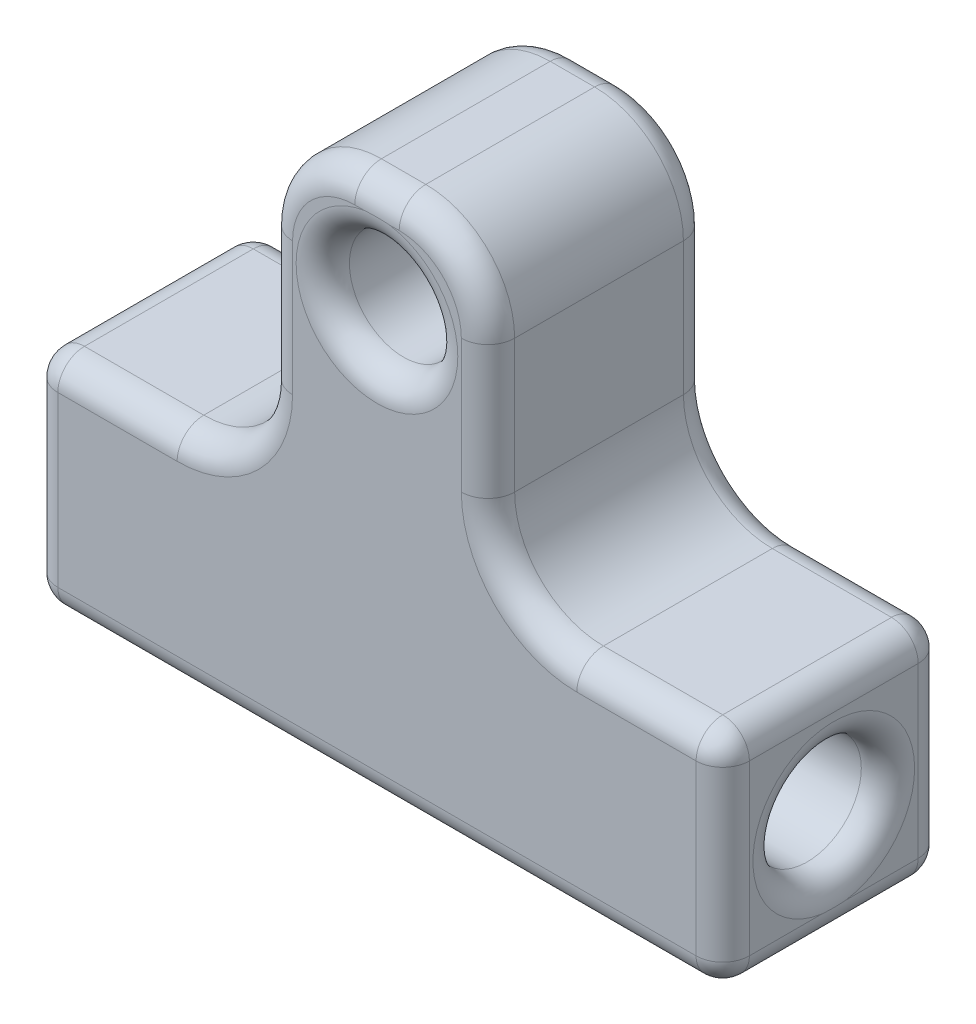
from build123d import *

# Parameters (mm, degrees)
SKETCH1_R           = 6.1
BOSS_EXTRUDE1_DEPTH = 25
SKETCH2_R           = 6.1
CUT_EXTRUDE1_DEPTH  = 88.09658729287669
FILLET1_R           = 3


with BuildPart() as part:
    # Sketch1 → Boss-Extrude1 (new body)
    with BuildSketch(Plane.XY):
        with BuildLine():
            Line((22.500000000000078, -5.000000000000004), (38.925619834710695, -5.000000000000004))
            Line((38.925619834710695, -5.000000000000004), (38.925619834710695, -30.000000000000007))
            Line((38.925619834710695, -30.000000000000007), (-38.92561983471068, -30.000000000000007))
            Line((-38.92561983471068, -30.000000000000007), (-38.92561983471068, -5.000000000000004))
            Line((-38.92561983471068, -5.000000000000004), (-22.500000000000068, -5.000000000000004))
            ThreePointArc((-22.500000000000068, -5.000000000000004), (-15.42893218813452, -2.0710678118654817), (-12.499999999999995, 5.000000000000067))
            Line((-12.499999999999995, 5.000000000000067), (-12.499999999999998, 19.99999999999993))
            ThreePointArc((-12.499999999999998, 19.99999999999993), (-9.571067811865476, 27.071067811865476), (-2.4999999999999294, 30))
            Line((-2.4999999999999294, 30), (2.499999999999931, 30))
            ThreePointArc((2.499999999999931, 30), (9.571067811865479, 27.071067811865476), (12.500000000000002, 19.99999999999993))
            Line((12.500000000000002, 19.99999999999993), (12.500000000000005, 5.000000000000065))
            ThreePointArc((12.500000000000005, 5.000000000000065), (15.428932188134532, -2.0710678118654826), (22.500000000000078, -5.000000000000004))
        make_face()
        with Locations((3.04e-15, 18)):
            Circle(SKETCH1_R, mode=Mode.SUBTRACT)
    extrude(amount=BOSS_EXTRUDE1_DEPTH)

    # Sketch2 → Cut-Extrude1 (cut, through all)
    with BuildSketch(Plane(origin=(38.925619834710695, 0, 0), x_dir=(0, 0, -1), z_dir=(1, 0, 0))):
        with Locations((-12.499999999999998, -18.000000000000007)):
            Circle(SKETCH2_R)
    extrude(amount=-CUT_EXTRUDE1_DEPTH, mode=Mode.SUBTRACT)

    # Fillet1
    # the kernel refuses this fillet: 3 mm, written as the material it takes off along each edge
    with BuildSketch(Plane(origin=(-35.92561983471068, -8.000000000000004, 22), x_dir=(0, 1, 0), z_dir=(-1, 0, 0))) as fillet1_piece_1_section:
        Polygon((0, 0), (FILLET1_R, 0), (FILLET1_R, -FILLET1_R), (0, -FILLET1_R), align=None)
    fillet1_piece_1 = extrude(amount=FILLET1_R, mode=Mode.PRIVATE)
    fillet1_piece_1 = fillet1_piece_1 - Plane(origin=(-35.92561983471068, -8.000000000000004, 22), x_dir=(0, -0.7071067811865475, -0.7071067811865475), z_dir=(-1, 0, 0)) * Sphere(FILLET1_R, mode=Mode.PRIVATE)
    add(fillet1_piece_1, mode=Mode.SUBTRACT)
    with BuildSketch(Plane(origin=(35.925619834710695, -8.000000000000004, 3), x_dir=(1, 0, 0), z_dir=(0, 1, 0))) as fillet1_piece_2_section:
        Polygon((0, 0), (FILLET1_R, 0), (FILLET1_R, FILLET1_R), (0, FILLET1_R), align=None)
    fillet1_piece_2 = extrude(amount=FILLET1_R, mode=Mode.PRIVATE)
    fillet1_piece_2 = fillet1_piece_2 - Plane(origin=(35.925619834710695, -8.000000000000004, 3), x_dir=(-0.7071067811865475, 0, 0.7071067811865475), z_dir=(0, 1, 0)) * Sphere(FILLET1_R, mode=Mode.PRIVATE)
    add(fillet1_piece_2, mode=Mode.SUBTRACT)
    with BuildSketch(Plane(origin=(-35.92561983471068, -27.000000000000007, 22), x_dir=(0, 0, 1), z_dir=(-1, 0, 0))) as fillet1_piece_3_section:
        Polygon((0, 0), (FILLET1_R, 0), (FILLET1_R, -FILLET1_R), (0, -FILLET1_R), align=None)
    fillet1_piece_3 = extrude(amount=FILLET1_R, mode=Mode.PRIVATE)
    fillet1_piece_3 = fillet1_piece_3 - Plane(origin=(-35.92561983471068, -27.000000000000007, 22), x_dir=(0, 0.7071067811865475, -0.7071067811865475), z_dir=(-1, 0, 0)) * Sphere(FILLET1_R, mode=Mode.PRIVATE)
    add(fillet1_piece_3, mode=Mode.SUBTRACT)
    with BuildSketch(Plane(origin=(35.925619834710695, -27.000000000000007, 3), x_dir=(0, 0, -1), z_dir=(1, 0, 0))) as fillet1_piece_4_section:
        Polygon((0, 0), (FILLET1_R, 0), (FILLET1_R, -FILLET1_R), (0, -FILLET1_R), align=None)
    fillet1_piece_4 = extrude(amount=FILLET1_R, mode=Mode.PRIVATE)
    fillet1_piece_4 = fillet1_piece_4 - Plane(origin=(35.925619834710695, -27.000000000000007, 3), x_dir=(0, 0.7071067811865475, 0.7071067811865475), z_dir=(1, 0, 0)) * Sphere(FILLET1_R, mode=Mode.PRIVATE)
    add(fillet1_piece_4, mode=Mode.SUBTRACT)
    with BuildSketch(Plane(origin=(-35.92561983471068, -27.000000000000007, 3), x_dir=(0, 0, -1), z_dir=(-1, 0, 0))) as fillet1_piece_5_section:
        Polygon((0, 0), (FILLET1_R, 0), (FILLET1_R, FILLET1_R), (0, FILLET1_R), align=None)
    fillet1_piece_5 = extrude(amount=FILLET1_R, mode=Mode.PRIVATE)
    fillet1_piece_5 = fillet1_piece_5 - Plane(origin=(-35.92561983471068, -27.000000000000007, 3), x_dir=(0, 0.7071067811865475, 0.7071067811865475), z_dir=(-1, 0, 0)) * Sphere(FILLET1_R, mode=Mode.PRIVATE)
    add(fillet1_piece_5, mode=Mode.SUBTRACT)
    with BuildSketch(Plane(origin=(-35.92561983471068, -8.000000000000004, 3), x_dir=(0, 1, 0), z_dir=(-1, 0, 0))) as fillet1_piece_6_section:
        Polygon((0, 0), (FILLET1_R, 0), (FILLET1_R, FILLET1_R), (0, FILLET1_R), align=None)
    fillet1_piece_6 = extrude(amount=FILLET1_R, mode=Mode.PRIVATE)
    fillet1_piece_6 = fillet1_piece_6 - Plane(origin=(-35.92561983471068, -8.000000000000004, 3), x_dir=(0, -0.7071067811865475, 0.7071067811865475), z_dir=(-1, 0, 0)) * Sphere(FILLET1_R, mode=Mode.PRIVATE)
    add(fillet1_piece_6, mode=Mode.SUBTRACT)
    with BuildSketch(Plane(origin=(35.925619834710695, -27.000000000000007, 22), x_dir=(0, 0, 1), z_dir=(1, 0, 0))) as fillet1_piece_7_section:
        Polygon((0, 0), (FILLET1_R, 0), (FILLET1_R, FILLET1_R), (0, FILLET1_R), align=None)
    fillet1_piece_7 = extrude(amount=FILLET1_R, mode=Mode.PRIVATE)
    fillet1_piece_7 = fillet1_piece_7 - Plane(origin=(35.925619834710695, -27.000000000000007, 22), x_dir=(0, 0.7071067811865475, -0.7071067811865475), z_dir=(1, 0, 0)) * Sphere(FILLET1_R, mode=Mode.PRIVATE)
    add(fillet1_piece_7, mode=Mode.SUBTRACT)
    with BuildSketch(Plane(origin=(35.925619834710695, -8.000000000000004, 22), x_dir=(1, 0, 0), z_dir=(0, 1, 0))) as fillet1_piece_8_section:
        Polygon((0, 0), (FILLET1_R, 0), (FILLET1_R, -FILLET1_R), (0, -FILLET1_R), align=None)
    fillet1_piece_8 = extrude(amount=FILLET1_R, mode=Mode.PRIVATE)
    fillet1_piece_8 = fillet1_piece_8 - Plane(origin=(35.925619834710695, -8.000000000000004, 22), x_dir=(-0.7071067811865475, 0, -0.7071067811865475), z_dir=(0, 1, 0)) * Sphere(FILLET1_R, mode=Mode.PRIVATE)
    add(fillet1_piece_8, mode=Mode.SUBTRACT)
    with BuildSketch(Plane(origin=(-35.92561983471068, -5.000000000000004, 25), x_dir=(0, -1, 0), z_dir=(1, 0, 0))) as fillet1_piece_9:
        with BuildLine():
            CenterArc((FILLET1_R, FILLET1_R), FILLET1_R, 180, 90)
            Line((-8.9e-16, FILLET1_R), (0, 0))
            Line((0, 0), (FILLET1_R, 0))
        make_face()
    extrude(amount=13.425619834710613, mode=Mode.SUBTRACT)
    with BuildSketch(Plane(origin=(-2.499999999999999, 20, 0), x_dir=(-1, -7.11e-15, 0), z_dir=(7.11e-15, -1, 0))) as fillet1_piece_10:
        with BuildLine():
            CenterArc((10 - FILLET1_R, -FILLET1_R), FILLET1_R, 8.48e-15, 90)
            Line((10, -FILLET1_R), (10, 0))
            Line((10, 0), (10 - FILLET1_R, 0))
        make_face()
    revolve(axis=Axis((-2.499999999999999, 20, 0), (0, 0, -1)), revolution_arc=90.00000000000081, mode=Mode.SUBTRACT)
    with BuildSketch(Plane(origin=(-2.4999999999999294, 30, 0), x_dir=(0, -1, 0), z_dir=(1, 0, 0))) as fillet1_piece_11:
        with BuildLine():
            CenterArc((FILLET1_R, -FILLET1_R), FILLET1_R, 90, 90)
            Line((0, -FILLET1_R), (0, 0))
            Line((0, 0), (FILLET1_R, 0))
        make_face()
    extrude(amount=4.999999999999861, mode=Mode.SUBTRACT)
    with BuildSketch(Plane(origin=(2.500000000000006, 20.000000000000007, 0), x_dir=(-7.51e-15, 1, 0), z_dir=(-1, -7.51e-15, 0))) as fillet1_piece_12:
        with BuildLine():
            CenterArc((9.999999999999993 - FILLET1_R, -FILLET1_R), FILLET1_R, 8.48e-15, 90)
            Line((9.999999999999993, -FILLET1_R), (9.999999999999993, 0))
            Line((9.999999999999993, 0), (9.999999999999993 - FILLET1_R, 0))
        make_face()
    revolve(axis=Axis((2.500000000000006, 20.000000000000007, 0), (0, 0, -1)), revolution_arc=90.00000000000088, mode=Mode.SUBTRACT)
    with BuildSketch(Plane(origin=(12.500000000000002, 19.99999999999993, 0), x_dir=(-1, -2.4e-16, 0), z_dir=(2.4e-16, -1, 0))) as fillet1_piece_13:
        with BuildLine():
            CenterArc((FILLET1_R, -FILLET1_R), FILLET1_R, 90, 90)
            Line((0, -FILLET1_R), (0, 0))
            Line((0, 0), (FILLET1_R, 0))
        make_face()
    extrude(amount=14.999999999999865, mode=Mode.SUBTRACT)
    with BuildSketch(Plane(origin=(22.500000000000004, 4.999999999999995, 0), x_dir=(-1, 7.02e-15, 0), z_dir=(7.02e-15, 1, 0))) as fillet1_piece_14:
        with BuildLine():
            CenterArc((9.999999999999998 + FILLET1_R, FILLET1_R), FILLET1_R, 180, 90)
            Line((9.999999999999998 + FILLET1_R, -4.4e-16), (9.999999999999998, 0))
            Line((9.999999999999998, 0), (9.999999999999998, FILLET1_R))
        make_face()
    revolve(axis=Axis((22.500000000000004, 4.999999999999995, 0), (0, 0, 1)), revolution_arc=90.00000000000082, mode=Mode.SUBTRACT)
    with BuildSketch(Plane(origin=(22.500000000000078, -5.000000000000004, 0), x_dir=(0, 3e-16, 1), z_dir=(1, 0, 0))) as fillet1_piece_15:
        with BuildLine():
            CenterArc((FILLET1_R, FILLET1_R), FILLET1_R, 180, 90)
            Line((-1.33e-15, FILLET1_R), (0, 0))
            Line((0, 0), (FILLET1_R, 0))
        make_face()
    extrude(amount=13.425619834710616, mode=Mode.SUBTRACT)
    with BuildSketch(Plane(origin=(-38.92561983471068, -27.000000000000007, 25), x_dir=(1, 0, 0), z_dir=(0, 1, 0))) as fillet1_piece_16:
        with BuildLine():
            CenterArc((FILLET1_R, FILLET1_R), FILLET1_R, 180, 90)
            Line((0, FILLET1_R), (0, 0))
            Line((0, 0), (FILLET1_R, 0))
        make_face()
    extrude(amount=19.000000000000004, mode=Mode.SUBTRACT)
    with BuildSketch(Plane(origin=(38.925619834710695, -8.000000000000004, 0), x_dir=(0, 0, 1), z_dir=(0, -1, 0))) as fillet1_piece_17:
        with BuildLine():
            CenterArc((FILLET1_R, FILLET1_R), FILLET1_R, 180, 90)
            Line((-4.4e-16, FILLET1_R), (0, 0))
            Line((0, 0), (FILLET1_R, 0))
        make_face()
    extrude(amount=19.000000000000004, mode=Mode.SUBTRACT)
    with BuildSketch(Plane(origin=(35.925619834710695, -30.000000000000007, 0), x_dir=(0, 1, 0), z_dir=(-1, 0, 0))) as fillet1_piece_18:
        with BuildLine():
            CenterArc((FILLET1_R, -FILLET1_R), FILLET1_R, 90, 90)
            Line((0, -FILLET1_R), (0, 0))
            Line((0, 0), (FILLET1_R, 0))
        make_face()
    extrude(amount=71.85123966942137, mode=Mode.SUBTRACT)
    with BuildSketch(Plane(origin=(-38.92561983471068, -27.000000000000007, 0), x_dir=(1, 0, 0), z_dir=(0, 1, 0))) as fillet1_piece_19:
        with BuildLine():
            CenterArc((FILLET1_R, -FILLET1_R), FILLET1_R, 90, 90)
            Line((0, -FILLET1_R), (0, 0))
            Line((0, 0), (FILLET1_R, 0))
        make_face()
    extrude(amount=19.000000000000004, mode=Mode.SUBTRACT)
    with BuildSketch(Plane(origin=(-35.92561983471068, -5.000000000000004, 0), x_dir=(0, -1, 0), z_dir=(1, 0, 0))) as fillet1_piece_20:
        with BuildLine():
            CenterArc((FILLET1_R, -FILLET1_R), FILLET1_R, 90, 90)
            Line((-8.9e-16, -FILLET1_R), (0, 0))
            Line((0, 0), (FILLET1_R, 0))
        make_face()
    extrude(amount=13.425619834710613, mode=Mode.SUBTRACT)
    with BuildSketch(Plane(origin=(-22.499999999999993, 4.999999999999993, 0), x_dir=(-7.46e-15, -1, 0), z_dir=(-1, 7.46e-15, 0))) as fillet1_piece_21:
        with BuildLine():
            CenterArc((9.999999999999998 + FILLET1_R, FILLET1_R), FILLET1_R, 180, 90)
            Line((9.999999999999998, FILLET1_R), (9.999999999999998, 0))
            Line((9.999999999999998, 0), (9.999999999999998 + FILLET1_R, 0))
        make_face()
    revolve(axis=Axis((-22.499999999999993, 4.999999999999993, 0), (0, 0, 1)), revolution_arc=90.00000000000085, mode=Mode.SUBTRACT)
    with BuildSketch(Plane(origin=(-12.499999999999995, 5.000000000000067, 0), x_dir=(1, 2.4e-16, 0), z_dir=(-2.4e-16, 1, 0))) as fillet1_piece_22:
        with BuildLine():
            CenterArc((FILLET1_R, -FILLET1_R), FILLET1_R, 90, 90)
            Line((0, -FILLET1_R), (0, 0))
            Line((0, 0), (FILLET1_R, 0))
        make_face()
    extrude(amount=14.999999999999861, mode=Mode.SUBTRACT)
    with BuildSketch(Plane(origin=(35.925619834710695, -30.000000000000007, 25), x_dir=(0, 1, 0), z_dir=(-1, 0, 0))) as fillet1_piece_23:
        with BuildLine():
            CenterArc((FILLET1_R, FILLET1_R), FILLET1_R, 180, 90)
            Line((0, FILLET1_R), (0, 0))
            Line((0, 0), (FILLET1_R, 0))
        make_face()
    extrude(amount=71.85123966942137, mode=Mode.SUBTRACT)
    with BuildSketch(Plane(origin=(38.925619834710695, -8.000000000000004, 25), x_dir=(0, 0, -1), z_dir=(0, -1, 0))) as fillet1_piece_24:
        with BuildLine():
            CenterArc((FILLET1_R, -FILLET1_R), FILLET1_R, 90, 90)
            Line((0, -FILLET1_R), (0, 0))
            Line((0, 0), (FILLET1_R, 0))
        make_face()
    extrude(amount=19.000000000000004, mode=Mode.SUBTRACT)
    with BuildSketch(Plane(origin=(38.925619834710695, -5.000000000000004, 3), x_dir=(-1, 3e-16, 0), z_dir=(0, 0, 1))) as fillet1_piece_25:
        with BuildLine():
            CenterArc((FILLET1_R, FILLET1_R), FILLET1_R, 180, 90)
            Line((-8.9e-16, FILLET1_R), (0, 0))
            Line((0, 0), (FILLET1_R, 0))
        make_face()
    extrude(amount=19, mode=Mode.SUBTRACT)
    with BuildSketch(Plane(origin=(38.925619834710695, -30.000000000000007, 3), x_dir=(0, 1, 0), z_dir=(0, 0, 1))) as fillet1_piece_26:
        with BuildLine():
            CenterArc((FILLET1_R, FILLET1_R), FILLET1_R, 180, 90)
            Line((0, FILLET1_R), (0, 0))
            Line((0, 0), (FILLET1_R, 0))
        make_face()
    extrude(amount=19, mode=Mode.SUBTRACT)
    with BuildSketch(Plane(origin=(-38.92561983471068, -30.000000000000007, 3), x_dir=(1, 0, 0), z_dir=(0, 0, 1))) as fillet1_piece_27:
        with BuildLine():
            CenterArc((FILLET1_R, FILLET1_R), FILLET1_R, 180, 90)
            Line((0, FILLET1_R), (0, 0))
            Line((0, 0), (FILLET1_R, 0))
        make_face()
    extrude(amount=19, mode=Mode.SUBTRACT)
    with BuildSketch(Plane(origin=(-38.92561983471068, -5.000000000000004, 3), x_dir=(0, -1, 0), z_dir=(0, 0, 1))) as fillet1_piece_28:
        with BuildLine():
            CenterArc((FILLET1_R, FILLET1_R), FILLET1_R, 180, 90)
            Line((-8.9e-16, FILLET1_R), (0, 0))
            Line((0, 0), (FILLET1_R, 0))
        make_face()
    extrude(amount=19, mode=Mode.SUBTRACT)
    with BuildSketch(Plane(origin=(22.500000000000078, -5.000000000000004, 25), x_dir=(0, 3e-16, -1), z_dir=(1, 0, 0))) as fillet1_piece_29:
        with BuildLine():
            CenterArc((FILLET1_R, -FILLET1_R), FILLET1_R, 89.99999999999999, 90.00000000000001)
            Line((-8.9e-16, -FILLET1_R), (0, 0))
            Line((0, 0), (FILLET1_R, 0))
        make_face()
    extrude(amount=13.425619834710616, mode=Mode.SUBTRACT)
    with BuildSketch(Plane(origin=(22.500000000000004, 4.999999999999995, 25), x_dir=(-1, 7.02e-15, 0), z_dir=(7.02e-15, 1, 0))) as fillet1_piece_30:
        with BuildLine():
            CenterArc((9.999999999999998 + FILLET1_R, -FILLET1_R), FILLET1_R, 90, 90)
            Line((9.999999999999998 + FILLET1_R, 0), (9.999999999999998, 0))
            Line((9.999999999999998, 0), (9.999999999999998, -FILLET1_R))
        make_face()
    revolve(axis=Axis((22.500000000000004, 4.999999999999995, 25), (0, 0, 1)), revolution_arc=90.00000000000082, mode=Mode.SUBTRACT)
    with BuildSketch(Plane(origin=(12.500000000000002, 19.99999999999993, 25), x_dir=(-1, -2.4e-16, 0), z_dir=(2.4e-16, -1, 0))) as fillet1_piece_31:
        with BuildLine():
            CenterArc((FILLET1_R, FILLET1_R), FILLET1_R, 180, 90)
            Line((0, FILLET1_R), (0, 0))
            Line((0, 0), (FILLET1_R, 0))
        make_face()
    extrude(amount=14.999999999999865, mode=Mode.SUBTRACT)
    with BuildSketch(Plane(origin=(3.04e-15, 18, 0), x_dir=(1, 0, 0), z_dir=(0, -1, 0))) as fillet1_piece_32:
        with BuildLine():
            CenterArc((6.1 + FILLET1_R, FILLET1_R), FILLET1_R, 180, 90)
            Line((6.099999999999999, FILLET1_R), (6.1, 0))
            Line((6.1, 0), (6.1 + FILLET1_R, 0))
        make_face()
    revolve(axis=Axis((3.04e-15, 18, 0), (0, 0, 1)), mode=Mode.SUBTRACT)
    with BuildSketch(Plane(origin=(3.04e-15, 18, 25), x_dir=(1, 0, 0), z_dir=(0, -1, 0))) as fillet1_piece_33:
        with BuildLine():
            CenterArc((6.1 + FILLET1_R, -FILLET1_R), FILLET1_R, 90, 90)
            Line((6.099999999999999, -FILLET1_R), (6.1, 0))
            Line((6.1, 0), (6.1 + FILLET1_R, 0))
        make_face()
    revolve(axis=Axis((3.04e-15, 18, 25), (0, 0, 1)), mode=Mode.SUBTRACT)
    with BuildSketch(Plane(origin=(2.500000000000006, 20.000000000000007, 25), x_dir=(-7.51e-15, 1, 0), z_dir=(-1, -7.51e-15, 0))) as fillet1_piece_34:
        with BuildLine():
            CenterArc((9.999999999999993 - FILLET1_R, FILLET1_R), FILLET1_R, 270, 90)
            Line((9.999999999999993, FILLET1_R), (9.999999999999993, 0))
            Line((9.999999999999993, 0), (9.999999999999993 - FILLET1_R, 0))
        make_face()
    revolve(axis=Axis((2.500000000000006, 20.000000000000007, 25), (0, 0, -1)), revolution_arc=90.00000000000088, mode=Mode.SUBTRACT)
    with BuildSketch(Plane(origin=(-2.4999999999999294, 30, 25), x_dir=(0, -1, 0), z_dir=(1, 0, 0))) as fillet1_piece_35:
        with BuildLine():
            CenterArc((FILLET1_R, FILLET1_R), FILLET1_R, 180, 90)
            Line((0, FILLET1_R), (0, 0))
            Line((0, 0), (FILLET1_R, 0))
        make_face()
    extrude(amount=4.999999999999861, mode=Mode.SUBTRACT)
    with BuildSketch(Plane(origin=(-2.499999999999999, 20, 25), x_dir=(-1, -7.11e-15, 0), z_dir=(7.11e-15, -1, 0))) as fillet1_piece_36:
        with BuildLine():
            CenterArc((10 - FILLET1_R, FILLET1_R), FILLET1_R, 270, 90)
            Line((10, FILLET1_R), (10, 0))
            Line((10, 0), (10 - FILLET1_R, 0))
        make_face()
    revolve(axis=Axis((-2.499999999999999, 20, 25), (0, 0, -1)), revolution_arc=90.00000000000081, mode=Mode.SUBTRACT)
    with BuildSketch(Plane(origin=(-38.92561983471068, -18.000000000000007, 12.499999999999998), x_dir=(0, 0, -1), z_dir=(0, -1, 0))) as fillet1_piece_37:
        with BuildLine():
            CenterArc((6.1 + FILLET1_R, FILLET1_R), FILLET1_R, 180, 90)
            Line((6.1 + FILLET1_R, 0), (6.1, 0))
            Line((6.1, 0), (6.1, FILLET1_R))
        make_face()
    revolve(axis=Axis((-38.92561983471068, -18.000000000000007, 12.499999999999998), (1, 0, 0)), mode=Mode.SUBTRACT)
    with BuildSketch(Plane(origin=(38.925619834710695, -18.000000000000007, 12.499999999999998), x_dir=(0, 0, -1), z_dir=(0, -1, 0))) as fillet1_piece_38:
        with BuildLine():
            CenterArc((6.1 + FILLET1_R, -FILLET1_R), FILLET1_R, 90, 90)
            Line((6.1, -FILLET1_R), (6.1, 0))
            Line((6.1, 0), (6.1 + FILLET1_R, 0))
        make_face()
    revolve(axis=Axis((38.925619834710695, -18.000000000000007, 12.499999999999998), (1, 0, 0)), mode=Mode.SUBTRACT)
    with BuildSketch(Plane(origin=(-12.499999999999995, 5.000000000000067, 25), x_dir=(1, 2.4e-16, 0), z_dir=(-2.4e-16, 1, 0))) as fillet1_piece_39:
        with BuildLine():
            CenterArc((FILLET1_R, FILLET1_R), FILLET1_R, 180, 90)
            Line((0, FILLET1_R), (0, 0))
            Line((0, 0), (FILLET1_R, 0))
        make_face()
    extrude(amount=14.999999999999861, mode=Mode.SUBTRACT)
    with BuildSketch(Plane(origin=(-22.499999999999993, 4.999999999999993, 25), x_dir=(-7.46e-15, -1, 0), z_dir=(-1, 7.46e-15, 0))) as fillet1_piece_40:
        with BuildLine():
            CenterArc((9.999999999999998 + FILLET1_R, -FILLET1_R), FILLET1_R, 90, 90)
            Line((9.999999999999998, -FILLET1_R), (9.999999999999998, 0))
            Line((9.999999999999998, 0), (9.999999999999998 + FILLET1_R, 0))
        make_face()
    revolve(axis=Axis((-22.499999999999993, 4.999999999999993, 25), (0, 0, 1)), revolution_arc=90.00000000000085, mode=Mode.SUBTRACT)


solid = part.part
